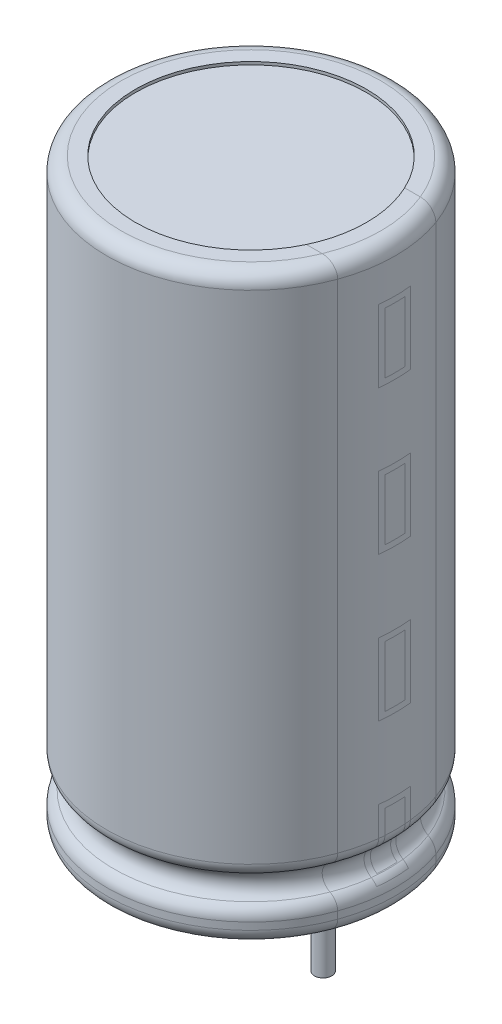
from build123d import *

# Parameters (mm, degrees)
BOSS_EXTRUDE1_DEPTH        = 1
BOSS_EXTRUDE1_DEPTH_BACK   = 3
SKETCH1_R                  = 0.3
BOSS_EXTRUDE1_2_DEPTH      = 1
BOSS_EXTRUDE1_2_DEPTH_BACK = 3


with BuildPart() as part:
    # Sketch1 → Boss-Extrude1 (new, two sides: drawn at the far end of the back side and taken through both)
    with BuildSketch(Plane(origin=(0, 0, 0), x_dir=(1, 0, 0), z_dir=(0, 1, 0)).offset(-BOSS_EXTRUDE1_DEPTH_BACK)):
        with Locations((-2.5, 0)):
            Circle(SKETCH1_R)
    extrude(amount=BOSS_EXTRUDE1_DEPTH + BOSS_EXTRUDE1_DEPTH_BACK)



with BuildPart() as body_2:
    # Sketch1 → Boss-Extrude1 2 (new, two sides: drawn at the far end of the back side and taken through both)
    with BuildSketch(Plane(origin=(0, 0, 0), x_dir=(1, 0, 0), z_dir=(0, 1, 0)).offset(-BOSS_EXTRUDE1_2_DEPTH_BACK)):
        with Locations((2.5, 0)):
            Circle(SKETCH1_R)
    extrude(amount=BOSS_EXTRUDE1_2_DEPTH + BOSS_EXTRUDE1_2_DEPTH_BACK)


with BuildPart() as part_1:
    add(part.part)

    add(body_2.part)  # Revolve1 merges body 2
    # Sketch3 → Revolve1 (revolve)
    with BuildSketch(Plane.XY):
        with BuildLine():
            Line((5, 0.5), (5, 0.75))
            ThreePointArc((5, 0.75), (4.933012702, 1), (4.75, 1.183012702))
            ThreePointArc((4.75, 1.183012702), (4.5, 1.616025404), (4.75, 2.049038106))
            ThreePointArc((4.75, 2.049038106), (4.933012702, 2.232050808), (5, 2.482050808))
            Line((5, 2.482050808), (5, 19.7))
            ThreePointArc((5, 19.7), (4.853553391, 20.053553391), (4.5, 20.2))
            Line((4.5, 20.2), (4, 20.2))
            Line((4, 20.2), (4, 20.1))
            Line((4, 20.1), (0, 20.1))
            Line((0, 20.1), (0, 0.1))
            Line((0, 0.1), (4, 0.1))
            Line((4, 0.1), (4, 0))
            Line((4, 0), (4.5, 0))
            ThreePointArc((4.5, 0), (4.853553391, 0.146446609), (5, 0.5))
        make_face()
    revolve(axis=Axis((0, 0.1, 0), (0, 1, 0)))


solid = part_1.part
